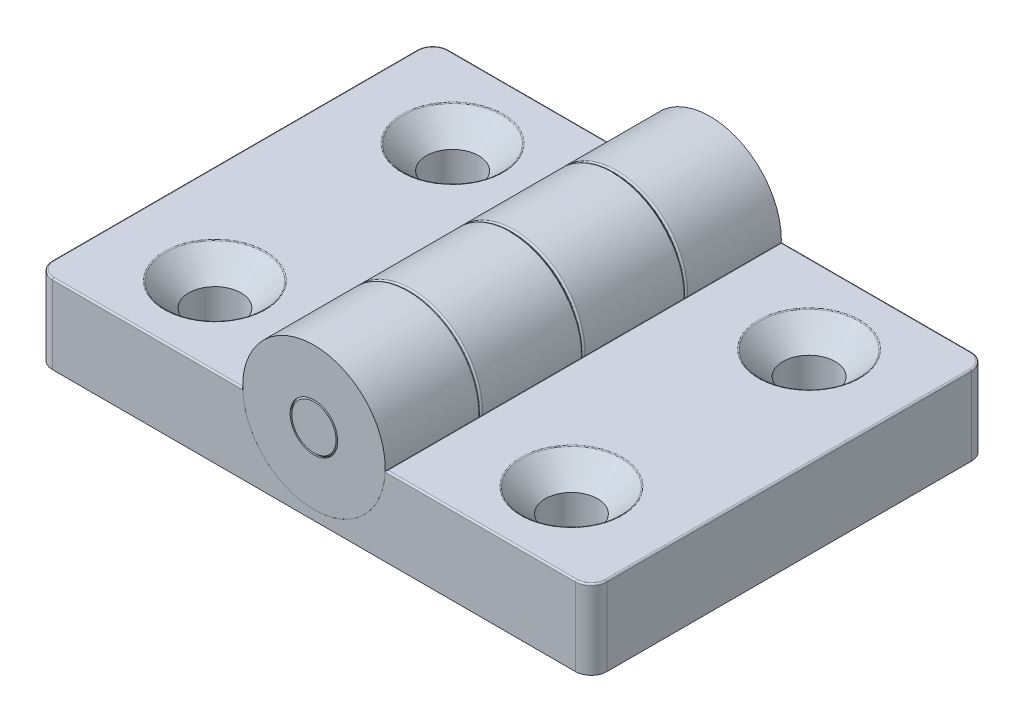
from build123d import *

# Parameters (mm, degrees)
SKETCH_1_R                  = 9
SKETCH_1_R_2                = 3
EXTRUDE_1_DEPTH             = 25
SKETCH_2_R                  = 3
EXTRUDE_2_DEPTH             = 25
CHAMFER_1_SIZE              = 0.2
SKETCH_3_W                  = 2
SKETCH_3_H                  = 0.1
SKETCH_3_W_2                = 4.105320606
FILLET_1_R                  = 0.2
EXTRUDE_6_DEPTH             = 50
HOLE_WIZARD_M6_1_AT_2_COUNT = 2
HOLE_WIZARD_M6_1_AT_2_PITCH = 45
HOLE_WIZARD_M6_1_AT_3_COUNT = 2
HOLE_WIZARD_M6_1_AT_3_PITCH = 30
HOLE_WIZARD_M6_1_AT_4_COUNT = 2
HOLE_WIZARD_M6_1_AT_4_PITCH = 54.083269132
FILLET_2_R                  = 0.2
FILLET_3_R                  = 2
CHAMFER_2_SIZE              = 0.5


with BuildPart() as part:
    # 草图1 → 凸台-拉伸1 (new, symmetric)
    with BuildSketch(Plane.XY):
        Circle(SKETCH_1_R)
        Circle(SKETCH_1_R_2, mode=Mode.SUBTRACT)
    extrude(amount=EXTRUDE_1_DEPTH, both=True)

    # 草图3 → 切除-旋转1 (revolve, cut)
    with BuildSketch(Plane(origin=(0, 0, 0), x_dir=(1, 0, 0), z_dir=(0, 1, 0))):
        with Locations((8, 12.95)):
            Rectangle(SKETCH_3_W, SKETCH_3_H)
        with Locations((8, 0)):
            Rectangle(SKETCH_3_W, SKETCH_3_H)
        with Locations((6.947339697, -12.95)):
            Rectangle(SKETCH_3_W_2, SKETCH_3_H)
    revolve(axis=Axis((0, 0, 25), (0, 0, -1)), mode=Mode.SUBTRACT)

    # 圆角1
    fillet_1_edges = [part.edges().sort_by_distance(p)[0] for p in [
        (-9, 0, -13),
        (-9, 0, -12.9),
        (-9, 0, -0.05),
        (-9, 0, 0.05),
        (-9, 0, 12.9),
        (-9, 0, 13),
    ]]
    fillet(fillet_1_edges, radius=FILLET_1_R)


with BuildPart() as body_2:
    # 草图2 → 凸台-拉伸2 (new, symmetric)
    with BuildSketch(Plane.XY):
        Circle(SKETCH_2_R)
    extrude(amount=EXTRUDE_2_DEPTH, both=True)

    # 倒角1
    chamfer_1_edges = [body_2.edges().sort_by_distance(p)[0] for p in [
        (-3, 0, 25),
    ]]
    chamfer(chamfer_1_edges, length=CHAMFER_1_SIZE)

    # 倒角2
    chamfer_2_edges = [body_2.edges().sort_by_distance(p)[0] for p in [
        (-3, 0, -25),
    ]]
    chamfer(chamfer_2_edges, length=CHAMFER_2_SIZE)


with BuildPart() as body_3:
    # 草图5 → 凸台-拉伸6 (new body)
    with BuildSketch(Plane(origin=(0, 0, -25), x_dir=(-1, 0, 0), z_dir=(0, 0, -1))):
        with BuildLine():
            Line((8.997777503, -0.2), (35, -0.2))
            Line((35, -0.2), (35, -10.2))
            Line((35, -10.2), (-35, -10.2))
            Line((-35, -10.2), (-35, -0.2))
            Line((-35, -0.2), (-8.997777503, -0.2))
            ThreePointArc((-8.997777503, -0.2), (0, -9), (8.997777503, -0.2))
        make_face()
    extrude(amount=-EXTRUDE_6_DEPTH)

    # 草图6 → M6 平头机械螺钉的锥形沉头孔1 (revolve, cut)
    with BuildSketch(Plane(origin=(-22.5, -0.2, -15), x_dir=(0, 0, 1), z_dir=(1, 0, 0))):
        Polygon((0, 0), (0, 10), (3.3, 10), (3.3, 3), (6.3, 0), align=None)
    hole_wizard_m6_1 = revolve(axis=Axis((-22.5, 6.15, -15), (0, -1, 0)), mode=Mode.SUBTRACT)

    # M6 平头机械螺钉的锥形沉头孔1 at 2: M6 平头机械螺钉的锥形沉头孔1 ×2
    with Locations(*[(i * HOLE_WIZARD_M6_1_AT_2_PITCH, 0, 0) for i in range(1, HOLE_WIZARD_M6_1_AT_2_COUNT)]):
        add(hole_wizard_m6_1, mode=Mode.SUBTRACT)

    # M6 平头机械螺钉的锥形沉头孔1 at 3: M6 平头机械螺钉的锥形沉头孔1 ×2
    with Locations(*[(0, 0, i * HOLE_WIZARD_M6_1_AT_3_PITCH) for i in range(1, HOLE_WIZARD_M6_1_AT_3_COUNT)]):
        add(hole_wizard_m6_1, mode=Mode.SUBTRACT)

    # M6 平头机械螺钉的锥形沉头孔1 at 4: M6 平头机械螺钉的锥形沉头孔1 ×2
    with Locations(*[Vector(0.8320502943378437, 0, 0.5547001962252291) * (i * HOLE_WIZARD_M6_1_AT_4_PITCH) for i in range(1, HOLE_WIZARD_M6_1_AT_4_COUNT)]):
        add(hole_wizard_m6_1, mode=Mode.SUBTRACT)

    # 圆角2
    # the kernel refuses this fillet: 0.2 mm, written as the material it takes off along each edge
    with BuildSketch(Plane(origin=(-8.497777503, -0.2, -25), x_dir=(0, 0, 1), z_dir=(-1, 0, 0)), Plane(origin=(35.5, -0.2, -25), x_dir=(0, 0, 1), z_dir=(-1, 0, 0))) as fillet_2_piece_1:
        with BuildLine():
            CenterArc((FILLET_2_R, -FILLET_2_R), FILLET_2_R, 90, 90)
            Line((0, -FILLET_2_R), (0, 0))
            Line((0, 0), (FILLET_2_R, 0))
        make_face()
    extrude(amount=27.002222497, mode=Mode.SUBTRACT)
    with BuildSketch(Plane(origin=(22.5, -0.2, 15), x_dir=(0, 0, 1), z_dir=(1, 0, 0))) as fillet_2_piece_2:
        with BuildLine():
            CenterArc((6.3 + FILLET_2_R * 0.414213562373, FILLET_2_R), FILLET_2_R, 225, 45)
            Line((6.3 - FILLET_2_R * 0.292893218813, FILLET_2_R * 0.292893218813), (6.3, 0))
            Line((6.3, 0), (6.3 + FILLET_2_R * 0.414213562373, 0))
        make_face()
    revolve(axis=Axis((22.5, -0.2, 15), (0, -1, 0)), mode=Mode.SUBTRACT)
    with BuildSketch(Plane(origin=(-22.5, -0.2, 15), x_dir=(0, 0, 1), z_dir=(1, 0, 0))) as fillet_2_piece_3:
        with BuildLine():
            CenterArc((6.3 + FILLET_2_R * 0.414213562373, FILLET_2_R), FILLET_2_R, 225, 45)
            Line((6.3 - FILLET_2_R * 0.292893218813, FILLET_2_R * 0.292893218813), (6.3, 0))
            Line((6.3, 0), (6.3 + FILLET_2_R * 0.414213562373, 0))
        make_face()
    revolve(axis=Axis((-22.5, -0.2, 15), (0, -1, 0)), mode=Mode.SUBTRACT)
    with BuildSketch(Plane(origin=(-35, -0.2, -25.5), x_dir=(1, 0, 0), z_dir=(0, 0, 1))) as fillet_2_piece_4:
        with BuildLine():
            CenterArc((FILLET_2_R, -FILLET_2_R), FILLET_2_R, 90, 90)
            Line((0, -FILLET_2_R), (0, 0))
            Line((0, 0), (FILLET_2_R, 0))
        make_face()
    extrude(amount=51, mode=Mode.SUBTRACT)
    with BuildSketch(Plane(origin=(-8.497777503, -0.2, 25), x_dir=(0, 0, -1), z_dir=(-1, 0, 0)), Plane(origin=(35.5, -0.2, 25), x_dir=(0, 0, -1), z_dir=(-1, 0, 0))) as fillet_2_piece_5:
        with BuildLine():
            CenterArc((FILLET_2_R, FILLET_2_R), FILLET_2_R, 180, 90)
            Line((0, FILLET_2_R), (0, 0))
            Line((0, 0), (FILLET_2_R, 0))
        make_face()
    extrude(amount=27.002222497, mode=Mode.SUBTRACT)
    with BuildSketch(Plane(origin=(22.5, -0.2, -15), x_dir=(0, 0, 1), z_dir=(1, 0, 0))) as fillet_2_piece_6:
        with BuildLine():
            CenterArc((6.3 + FILLET_2_R * 0.414213562373, FILLET_2_R), FILLET_2_R, 225, 45)
            Line((6.3 - FILLET_2_R * 0.292893218813, FILLET_2_R * 0.292893218813), (6.3, 0))
            Line((6.3, 0), (6.3 + FILLET_2_R * 0.414213562373, 0))
        make_face()
    revolve(axis=Axis((22.5, -0.2, -15), (0, -1, 0)), mode=Mode.SUBTRACT)
    with BuildSketch(Plane(origin=(-8.997777503, -0.2, -25.483806828), x_dir=(0.03285209900407031, -0.9994602241165111, 0), z_dir=(0, 0, 1))) as fillet_2_piece_7:
        with BuildLine():
            CenterArc((0.193534417, -0.199988692), FILLET_2_R, 90.609281004, 87.508093631)
            Line((-0.006357628, -0.193418272), (0, 0))
            ThreePointArc((0, 0), (0.095703833, -0.00050886), (0.191407665, 0))
        make_face()
    extrude(amount=50.967613655, mode=Mode.SUBTRACT)
    with BuildSketch(Plane(origin=(8.997777503, -0.2, -25.483806828), x_dir=(-0.03285209900407052, -0.9994602241165111, 0), z_dir=(0, 0, 1))) as fillet_2_piece_8:
        with BuildLine():
            CenterArc((0.193534417, 0.199988692), FILLET_2_R, 181.882625365, 87.508093631)
            Line((-0.006357628, 0.193418272), (0, 0))
            ThreePointArc((0, 0), (0.095703833, 0.00050886), (0.191407665, 0))
        make_face()
    extrude(amount=50.967613655, mode=Mode.SUBTRACT)
    with BuildSketch(Plane(origin=(35, -0.2, -25.5), x_dir=(-1, 0, 0), z_dir=(0, 0, 1))) as fillet_2_piece_9:
        with BuildLine():
            CenterArc((FILLET_2_R, FILLET_2_R), FILLET_2_R, 180, 90)
            Line((0, FILLET_2_R), (0, 0))
            Line((0, 0), (FILLET_2_R, 0))
        make_face()
    extrude(amount=51, mode=Mode.SUBTRACT)
    with BuildSketch(Plane(origin=(-22.5, -0.2, -15), x_dir=(0, 0, 1), z_dir=(1, 0, 0))) as fillet_2_piece_10:
        with BuildLine():
            CenterArc((6.3 + FILLET_2_R * 0.414213562373, FILLET_2_R), FILLET_2_R, 225, 45)
            Line((6.3 - FILLET_2_R * 0.292893218813, FILLET_2_R * 0.292893218813), (6.3, 0))
            Line((6.3, 0), (6.3 + FILLET_2_R * 0.414213562373, 0))
        make_face()
    revolve(axis=Axis((-22.5, -0.2, -15), (0, -1, 0)), mode=Mode.SUBTRACT)

    # 圆角3
    # the kernel refuses this fillet: 2 mm, written as the material it takes off along each edge
    with BuildSketch(Plane(origin=(33, -0.2, 23), x_dir=(0, 0, 1), z_dir=(-1, 0, 0))) as fillet_3_piece_1:
        with BuildLine():
            CenterArc((1.8, -0.2), 0.2, 0, 90)
            Line((2, -0.2), (2, 0))
            Line((2, 0), (1.8, 0))
        make_face()
    revolve(axis=Axis((33, -0.2, 23), (0, 1, 0)), revolution_arc=90, mode=Mode.SUBTRACT)
    with BuildSketch(Plane(origin=(33, -0.2, -23), x_dir=(1, 0, 0), z_dir=(0, 0, 1))) as fillet_3_piece_2:
        with BuildLine():
            CenterArc((1.8, -0.2), 0.2, 0, 90)
            Line((2, -0.2), (2, 0))
            Line((2, 0), (1.8, 0))
        make_face()
    revolve(axis=Axis((33, -0.2, -23), (0, 1, 0)), revolution_arc=90, mode=Mode.SUBTRACT)
    with BuildSketch(Plane(origin=(-33, -0.2, 23), x_dir=(-1, 0, 0), z_dir=(0, 0, -1))) as fillet_3_piece_3:
        with BuildLine():
            CenterArc((1.8, -0.2), 0.2, 0, 90)
            Line((2, -0.2), (2, 0))
            Line((2, 0), (1.8, 0))
        make_face()
    revolve(axis=Axis((-33, -0.2, 23), (0, 1, 0)), revolution_arc=90, mode=Mode.SUBTRACT)
    with BuildSketch(Plane(origin=(-33, -0.2, -23), x_dir=(0, 0, -1), z_dir=(1, 0, 0))) as fillet_3_piece_4:
        with BuildLine():
            CenterArc((1.8, -0.2), 0.2, 0, 90)
            Line((2, -0.2), (2, 0))
            Line((2, 0), (1.8, 0))
        make_face()
    revolve(axis=Axis((-33, -0.2, -23), (0, 1, 0)), revolution_arc=90, mode=Mode.SUBTRACT)
    with BuildSketch(Plane(origin=(-35, -0.2, -25), x_dir=(1, 0, 0), z_dir=(0, -1, 0)), Plane(origin=(35, -15.2, -25), x_dir=(-1, 0, 0), z_dir=(0, 1, 0))) as fillet_3_piece_5:
        with BuildLine():
            CenterArc((FILLET_3_R, FILLET_3_R), FILLET_3_R, 180, 90)
            Line((0, FILLET_3_R), (0, 0))
            Line((0, 0), (FILLET_3_R, 0))
        make_face()
    extrude(amount=15, mode=Mode.SUBTRACT)
    with BuildSketch(Plane(origin=(-35, -0.2, 25), x_dir=(1, 0, 0), z_dir=(0, -1, 0)), Plane(origin=(35, -15.2, 25), x_dir=(-1, 0, 0), z_dir=(0, 1, 0))) as fillet_3_piece_6:
        with BuildLine():
            CenterArc((FILLET_3_R, -FILLET_3_R), FILLET_3_R, 90, 90)
            Line((0, -FILLET_3_R), (0, 0))
            Line((0, 0), (FILLET_3_R, 0))
        make_face()
    extrude(amount=15, mode=Mode.SUBTRACT)


solid = Compound([part.part, body_2.part, body_3.part])
